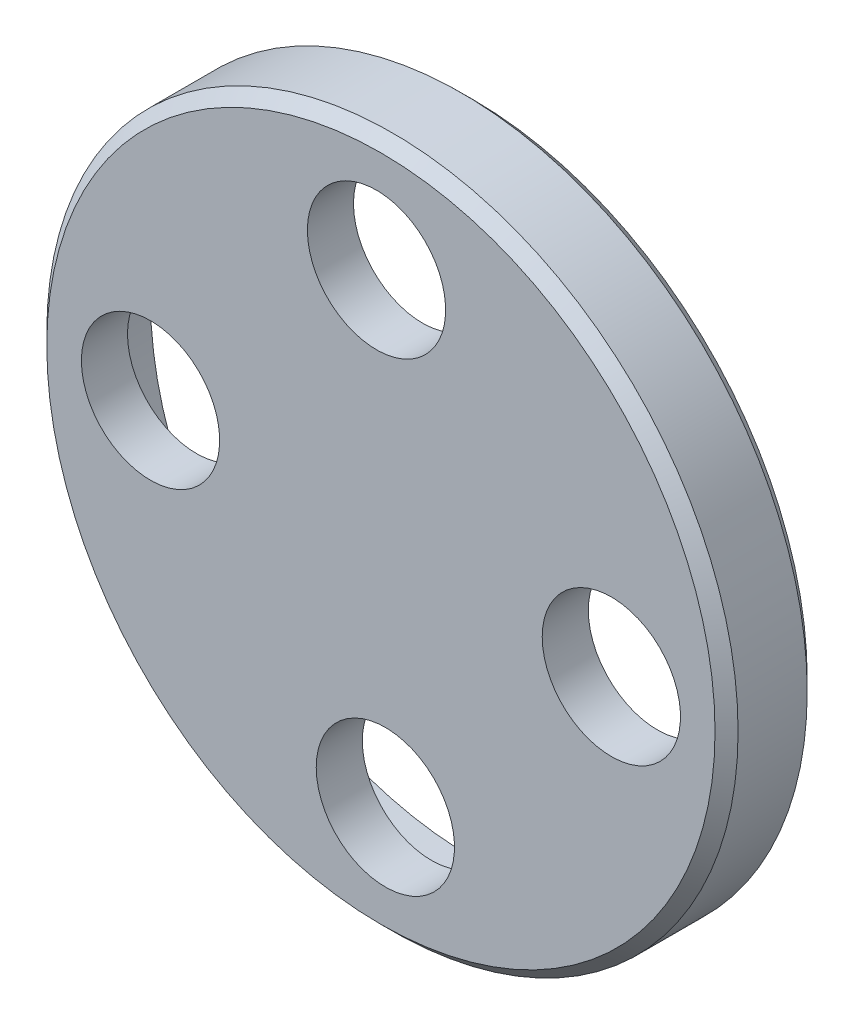
from build123d import *

# Parameters (mm, degrees)
SKETCH_1_R          = 15
EXTRUDE_1_DEPTH     = 4
SKETCH_3_R          = 14
CUT_EXTRUDE_2_DEPTH = 2
SKETCH_5_R          = 3
CUT_EXTRUDE_3_DEPTH = 22.307275753
CHAMFER_1_SIZE      = 0.5
CHAMFER_3_SIZE      = 0.5


with BuildPart() as part:
    # Эскиз1 → Вытянуть1 (new body)
    with BuildSketch(Plane.XY):
        Circle(SKETCH_1_R)
    extrude(amount=EXTRUDE_1_DEPTH)

    # Эскиз3 → Вытянуть2 (cut)
    with BuildSketch(Plane(origin=(0, 0, 0), x_dir=(-1, 0, 0), z_dir=(0, 0, -1))):
        Circle(SKETCH_3_R)
    extrude(amount=-CUT_EXTRUDE_2_DEPTH, mode=Mode.SUBTRACT)

    # Эскиз5 → Вытянуть3 (cut, through all)
    with BuildSketch(Plane(origin=(0, 0, 2), x_dir=(-1, 0, 0), z_dir=(0, 0, -1))):
        with Locations((9.998142701, 0.192724)):
            Circle(SKETCH_5_R)
        with Locations((-0.192724, -9.998142701)):
            Circle(SKETCH_5_R)
        with Locations((0.1908667, 10)):
            Circle(SKETCH_5_R)
        with Locations((-10, -0.1908667)):
            Circle(SKETCH_5_R)
    extrude(amount=-CUT_EXTRUDE_3_DEPTH, mode=Mode.SUBTRACT)

    # Фаска1
    chamfer_1_edges = [part.edges().sort_by_distance(p)[0] for p in [
        (-15, 0, 4),
    ]]
    chamfer(chamfer_1_edges, length=CHAMFER_1_SIZE)

    # Фаска3
    chamfer_3_edges = [part.edges().sort_by_distance(p)[0] for p in [
        (-15, 0, 0),
    ]]
    chamfer(chamfer_3_edges, length=CHAMFER_3_SIZE)


solid = part.part
